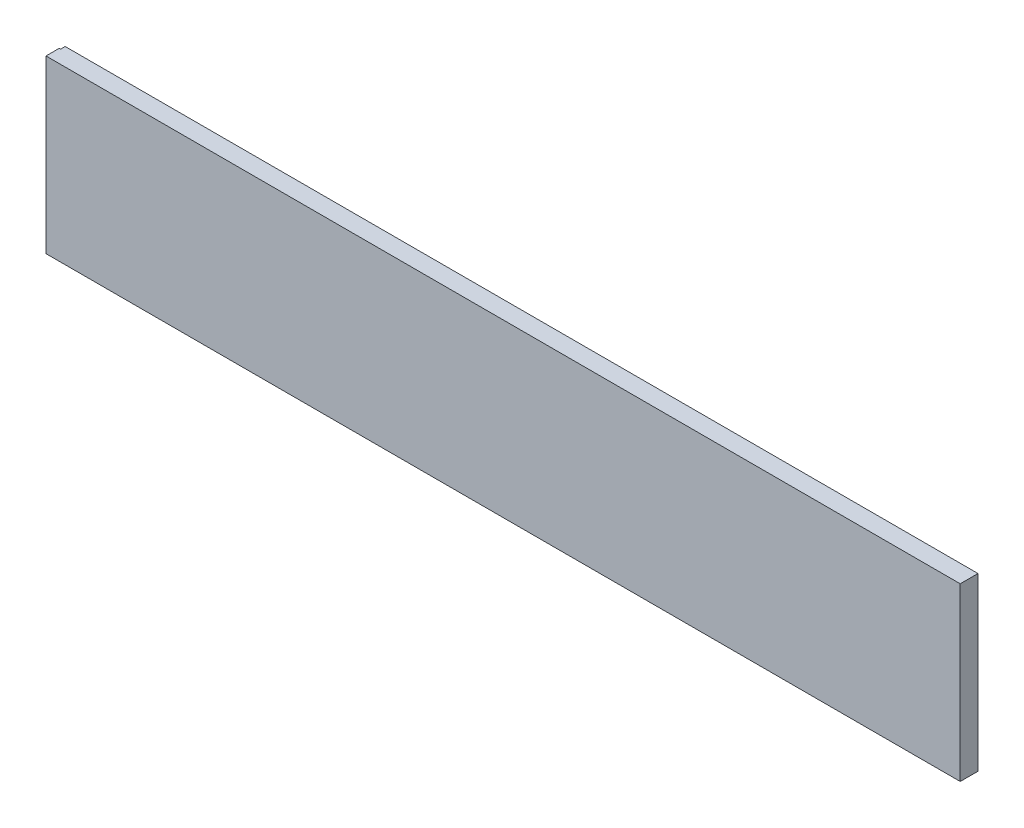
from build123d import *

# Parameters (mm, degrees)
SKETCH1_R           = 36
BOSS_EXTRUDE1_DEPTH = 20
SKETCH2_W           = 2056.908092605
SKETCH2_H           = 385.28
BOSS_EXTRUDE2_DEPTH = 10
BOSS_EXTRUDE3_START = 30
SKETCH3_R           = 36
BOSS_EXTRUDE3_DEPTH = 30
SKETCH4_W           = 2013.042913478
SKETCH4_H           = 345.28
BOSS_EXTRUDE4_DEPTH = 10


with BuildPart() as part:
    # Sketch1 → Boss-Extrude1 (new body)
    with BuildSketch(Plane.XY):
        Polygon((-406.4, 152.64), (-406.4, -152.64), (406.4, -152.64), (1650.508092605, -152.64), (1650.508092605, 232.64), (-406.4, 232.64), align=None)
        Circle(SKETCH1_R, mode=Mode.SUBTRACT)
    extrude(amount=BOSS_EXTRUDE1_DEPTH)

    # Sketch2 → Boss-Extrude2 (add)
    with BuildSketch(Plane.XY.offset(20)):
        with Locations((622.054046302, 40)):
            Rectangle(SKETCH2_W, SKETCH2_H)
    extrude(amount=BOSS_EXTRUDE2_DEPTH)

    # Sketch3 → Boss-Extrude3 (add)
    with BuildSketch(Plane(origin=(0, 0, 20), x_dir=(-1, 0, 0), z_dir=(0, 0, -1)).offset(BOSS_EXTRUDE3_START)):
        Circle(SKETCH3_R)
    extrude(amount=-BOSS_EXTRUDE3_DEPTH)

    # Sketch4 → Boss-Extrude4 (add)
    with BuildSketch(Plane(origin=(0, 0, 0), x_dir=(-1, 0, 0), z_dir=(0, 0, -1))):
        Polygon((-1630.508092605, 232.64), (-1650.508092605, 232.64), (-1650.508092605, -152.64), (403.233696812, -152.64), (403.233696812, 232.64), align=None)
        with Locations((-623.986635866, 40)):
            Rectangle(SKETCH4_W, SKETCH4_H, mode=Mode.SUBTRACT)
    extrude(amount=BOSS_EXTRUDE4_DEPTH)


solid = part.part
